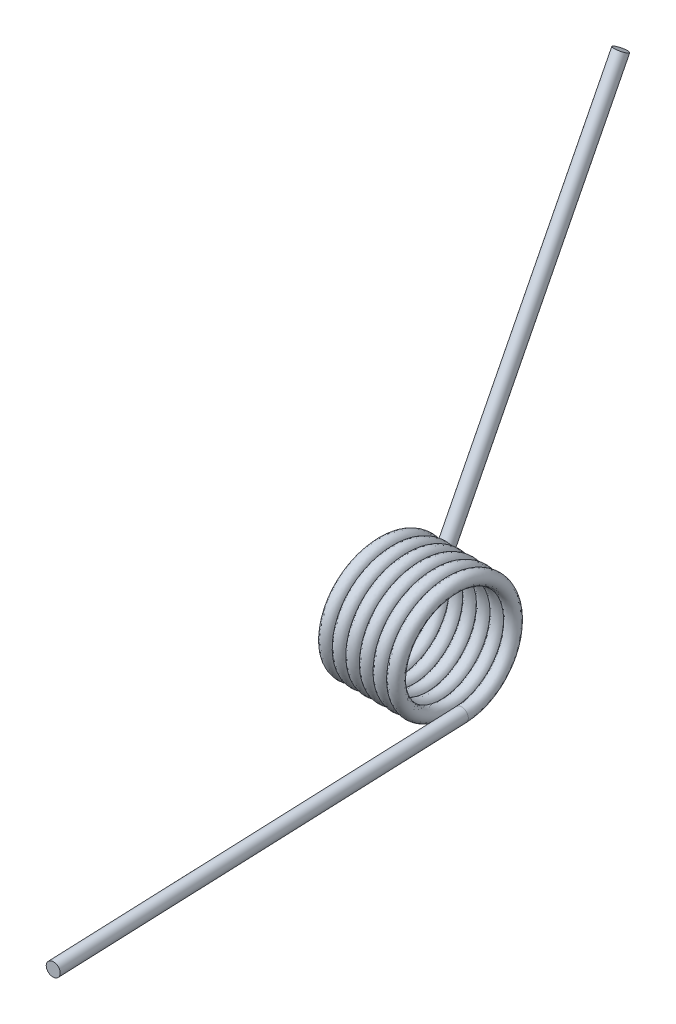
from build123d import *

# Parameters (mm, degrees)
SWEEP1_PITCH   = 2.4384
SKETCH4_R      = 1.2065
EXTRUDE1_DEPTH = 76.2
SKETCH5_R      = 1.2065
EXTRUDE2_DEPTH = 76.2


with BuildPart() as part:
    # Sweep1: the profile of Sketch3 screwed along a left-hand helix of 6.166667 turns, 6 arcs to a turn; built about Z, then put on its axis
    sweep1_z = Axis((0, 0, 0), (0, 0, 1))
    sweep1_corners = [(9.88323439, -0.047460601, -1.205240148), (11.061374251, 0.001103098, 0.028012679), (9.82716561, 0.047460601, 1.205240148), (8.649025749, -0.001103098, -0.028012679)]
    with BuildLine(mode=Mode.PRIVATE) as sweep1_profile:
        ThreePointArc((9.88323439, -0.047460601, -1.205240148), (10.727917299, -0.032779704, -0.832425526), (11.061374251, 0.001103098, 0.028012679))
        ThreePointArc((11.061374251, 0.001103098, 0.028012679), (10.688270685, 0.034339721, 0.872041437), (9.82716561, 0.047460601, 1.205240148))
        ThreePointArc((9.82716561, 0.047460601, 1.205240148), (8.982482701, 0.032779704, 0.832425526), (8.649025749, -0.001103098, -0.028012679))
        ThreePointArc((8.649025749, -0.001103098, -0.028012679), (9.022129315, -0.034339721, -0.872041437), (9.88323439, -0.047460601, -1.205240148))
    sweep1_cap = Face(sweep1_profile.wire())
    sweep1_arcs = [((9.88323439, -0.047460601, -1.205240148), (11.08940864, -0.046357502, -1.177227469), (11.061374251, 0.001103098, 0.028012679), (1, 0.7071067811865476, 1)), ((11.061374251, 0.001103098, 0.028012679), (11.033339861, 0.048563699, 1.233252827), (9.82716561, 0.047460601, 1.205240148), (1, 0.7071067811865476, 1)), ((9.82716561, 0.047460601, 1.205240148), (8.62099136, 0.046357502, 1.177227469), (8.649025749, -0.001103098, -0.028012679), (1, 0.7071067811865476, 1)), ((8.649025749, -0.001103098, -0.028012679), (8.677060139, -0.048563699, -1.233252827), (9.88323439, -0.047460601, -1.205240148), (1, 0.7071067811865476, 1))]  # start, shoulder, end, weights
    sweep1_turn_angles = [0, -30, -60, -90, -120, -150, -180, -210, -240, -270, -300, -330, -360]
    sweep1_turn_weights = [1, 0.8660254037844387, 1, 0.8660254037844387, 1, 0.8660254037844387, 1, 0.8660254037844387, 1, 0.8660254037844387, 1, 0.8660254037844387, 1]
    sweep1_turn_sides = [Face.make_bezier_surface([[Vector(p[j][0], p[j][1], 0).rotate(sweep1_z, sweep1_turn_angles[2 * i + k]) / sweep1_turn_weights[2 * i + k] + Vector(0, 0, p[j][2] + -SWEEP1_PITCH * sweep1_turn_angles[2 * i + k] / 360) for k in range(3)] for j in range(3)], [[p[3][j] * sweep1_turn_weights[2 * i + k] for k in range(3)] for j in range(3)]) for p in sweep1_arcs for i in range(6)]
    sweep1_last_angles = [-2160, -2190, -2220]
    sweep1_last_weights = [1, 0.866025403784403, 1]
    sweep1_last_sides = [Face.make_bezier_surface([[Vector(p[j][0], p[j][1], 0).rotate(sweep1_z, sweep1_last_angles[2 * i + k]) / sweep1_last_weights[2 * i + k] + Vector(0, 0, p[j][2] + -SWEEP1_PITCH * sweep1_last_angles[2 * i + k] / 360) for k in range(3)] for j in range(3)], [[p[3][j] * sweep1_last_weights[2 * i + k] for k in range(3)] for j in range(3)]) for p in sweep1_arcs for i in range(1)]
    sweep1 = Plane(origin=(0, 0, 0), x_dir=(0, -1, 0), z_dir=(-1, 0, 0)) * Solid(Shell([*[p.moved(Location((0, 0, SWEEP1_PITCH * i))) for i in range(6) for p in sweep1_turn_sides], *sweep1_last_sides, sweep1_cap, sweep1_cap.rotate(sweep1_z, -2220).moved(Location((0, 0, -SWEEP1_PITCH * -2220 / 360)))]))
    add(sweep1)

    # Sketch4 → Extrude1 (add)
    with BuildSketch(Plane(origin=(0, 0, 0), x_dir=(-0.9989557795402644, 0.023236129092747825, 0.03933742274079621), z_dir=(0.03934804652827866, -1.0745961412372829e-14, 0.9992255657429951))):
        with Locations(Location((-0.228996699, 9.852539142, 0), (0, 0, 181.33145196))):
            Circle(SKETCH4_R)
    extrude(amount=EXTRUDE1_DEPTH)

    # Sketch5 → Extrude2 (add)
    with BuildSketch(Plane(origin=(-0.023281008, 0.51200331, -0.295605249), x_dir=(0.9992255652040811, 0.03409282936814917, -0.019645580374703375), z_dir=(-0.03934804652827868, 0.8653547240443686, -0.4996127828713984))):
        with Locations(Location((-15.025478653, 9.854706523, 0), (0, 0, 180.001881766))):
            Circle(SKETCH5_R)
    extrude(amount=EXTRUDE2_DEPTH)


solid = part.part
